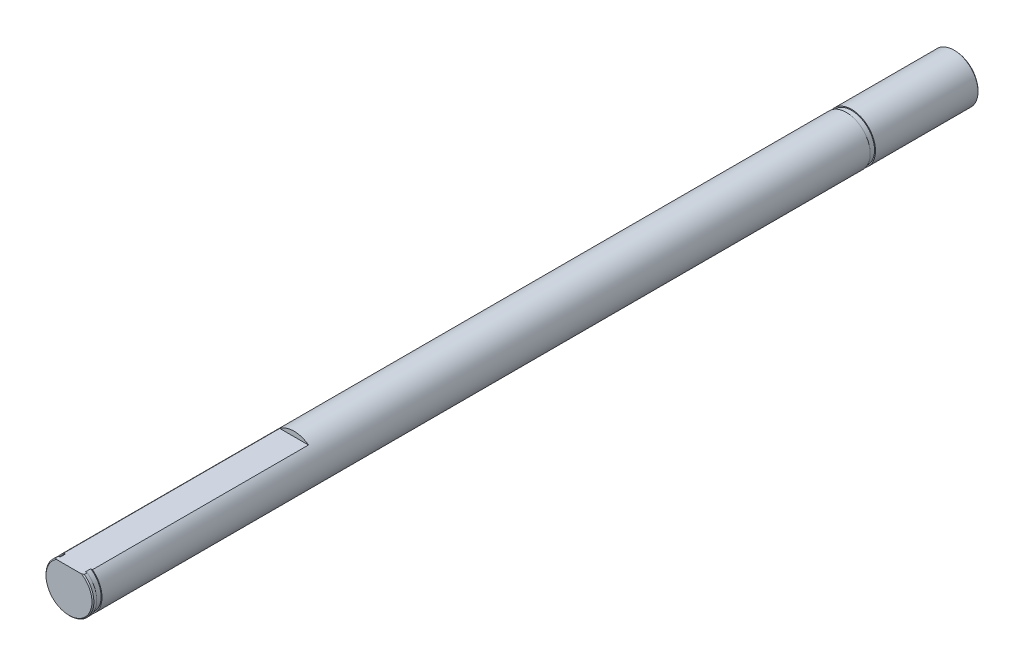
from build123d import *

# Parameters (mm, degrees)
SKIZZE1_R                       = 5
AUFSATZ_LINEAR_AUSTRAGEN1_DEPTH = 92.5
SKIZZE7_W                       = 1.1
SKIZZE7_H                       = 0.2
SCHNITT_LINEAR_AUSTRAGEN1_DEPTH = 47
FASE1_SIZE                      = 0.2


with BuildPart() as part:
    # Skizze1 → Aufsatz-Linear austragen1 (new, symmetric)
    with BuildSketch(Plane.XY):
        Circle(SKIZZE1_R)
    extrude(amount=AUFSATZ_LINEAR_AUSTRAGEN1_DEPTH, both=True)

    # Skizze7 → Schnitt-Rotation1 (revolve, cut)
    with BuildSketch(Plane(origin=(0, 0, 0), x_dir=(0, 0, -1), z_dir=(1, 0, 0))):
        with Locations((-91.15, 4.9)):
            Rectangle(SKIZZE7_W, SKIZZE7_H)
        with Locations((70.35, 4.9)):
            Rectangle(SKIZZE7_W, SKIZZE7_H)
    revolve(axis=Axis((0, 0, -92.5), (0, 0, 1)), mode=Mode.SUBTRACT)

    # Skizze8 → Schnitt-Linear austragen1 (cut)
    with BuildSketch(Plane.XY.offset(92.5)):
        with BuildLine():
            Line((3, 4), (-3, 4))
            ThreePointArc((-3, 4), (0, 5), (3, 4))
        make_face()
    extrude(amount=-SCHNITT_LINEAR_AUSTRAGEN1_DEPTH, mode=Mode.SUBTRACT)

    # Fase1
    fase1_edges = [part.edges().sort_by_distance(p)[0] for p in [
        (0, -5, 92.5),
        (-5, 0, -92.5),
    ]]
    chamfer(fase1_edges, length=FASE1_SIZE)


solid = part.part
